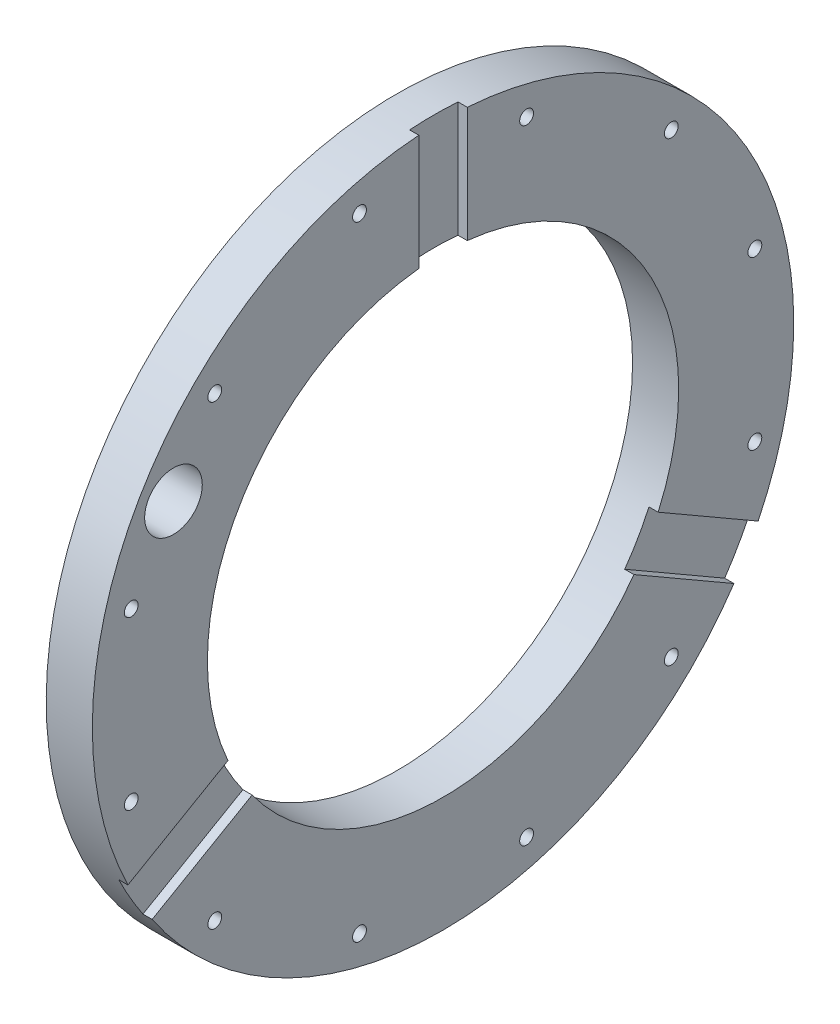
from build123d import *

# Parameters (mm, degrees)
ESQUISSE1_R                  = 76.05
ESQUISSE1_R_2                = 51.1
BOSS_EXTRU_1_DEPTH           = 10
ESQUISSE2_W                  = 10.5
ESQUISSE2_H                  = 49.549699789
ENL_V_MAT_EXTRU_1_DEPTH      = 2
R_P_TITION_CIRCULAIRE1_COUNT = 3
ESQUISSE3_R                  = 1.5
ENL_V_MAT_EXTRU_2_DEPTH      = 109.014836944
R_P_TITION_CIRCULAIRE2_COUNT = 12
ESQUISSE4_R                  = 6.25
ENL_V_MAT_EXTRU_3_DEPTH      = 10


with BuildPart() as part:
    # Esquisse1 → Boss.-Extru.1 (new body)
    with BuildSketch(Plane(origin=(0, 0, 0), x_dir=(0, 0, -1), z_dir=(1, 0, 0))):
        Circle(ESQUISSE1_R)
        Circle(ESQUISSE1_R_2, mode=Mode.SUBTRACT)
    extrude(amount=BOSS_EXTRU_1_DEPTH)

    # Esquisse2 → Enlèv. mat.-Extru.1 (cut)
    with BuildSketch(Plane(origin=(10, 0, 0), x_dir=(0, 0, -1), z_dir=(1, 0, 0))):
        with Locations((0, 61.034440209)):
            Rectangle(ESQUISSE2_W, ESQUISSE2_H)
    enl_v_mat_extru_1 = extrude(amount=-ENL_V_MAT_EXTRU_1_DEPTH, mode=Mode.SUBTRACT)

    # Répétition circulaire1: Enlèv. mat.-Extru.1 ×3 about axis
    r_p_tition_circulaire1_axis = Axis((0, 0, 0), (1, 0, 0))
    for i in range(1, R_P_TITION_CIRCULAIRE1_COUNT):
        add(enl_v_mat_extru_1.rotate(r_p_tition_circulaire1_axis, i * 360 / R_P_TITION_CIRCULAIRE1_COUNT), mode=Mode.SUBTRACT)

    # Esquisse3 → Enlèv. mat.-Extru.2 (cut, through all)
    with BuildSketch(Plane(origin=(10, 0, 0), x_dir=(0, 0, -1), z_dir=(1, 0, 0))):
        with Locations((18.117333157, 67.61480784)):
            Circle(ESQUISSE3_R)
    enl_v_mat_extru_2 = extrude(amount=-ENL_V_MAT_EXTRU_2_DEPTH, mode=Mode.SUBTRACT)

    # Répétition circulaire2: Enlèv. mat.-Extru.2 ×12 about axis
    r_p_tition_circulaire2_axis = Axis((0, 0, 0), (1, 0, 0))
    for i in range(1, R_P_TITION_CIRCULAIRE2_COUNT):
        add(enl_v_mat_extru_2.rotate(r_p_tition_circulaire2_axis, i * 360 / R_P_TITION_CIRCULAIRE2_COUNT), mode=Mode.SUBTRACT)

    # Esquisse4 → Enlèv. mat.-Extru.3 (cut)
    with BuildSketch(Plane(origin=(10, 0, 0), x_dir=(0, 0, -1), z_dir=(1, 0, 0))):
        with Locations((-58.456714755, 33.75)):
            Circle(ESQUISSE4_R)
    extrude(amount=-ENL_V_MAT_EXTRU_3_DEPTH, mode=Mode.SUBTRACT)


solid = part.part
